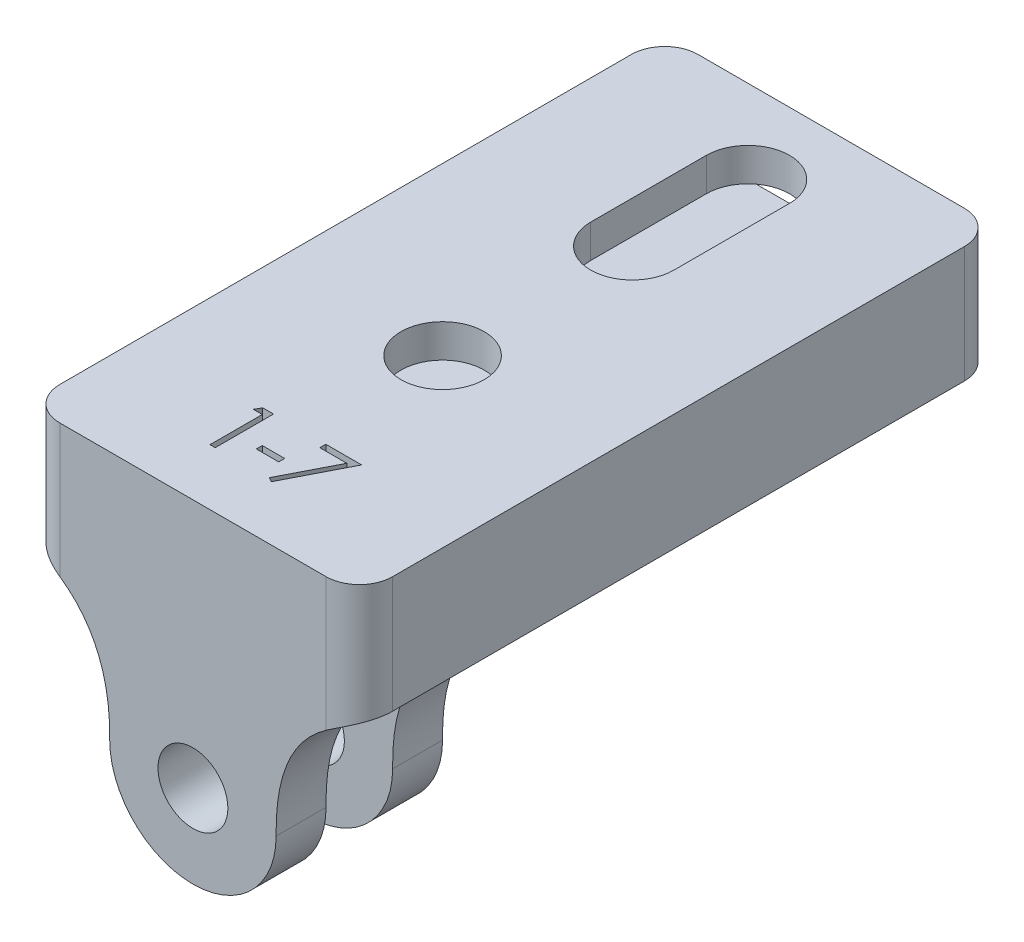
from build123d import *

# Parameters (mm, degrees)
SKETCH1_W           = 20
SKETCH1_H           = 38.345137774
SKETCH1_R           = 2.5
BOSS_EXTRUDE1_DEPTH = 3.5
SKETCH1_3_W         = 15
SKETCH1_3_H         = 28.345137774
SKETCH1_3_R         = 2.5
CUT_EXTRUDE1_DEPTH  = 1.5
SKETCH4_R           = 2.1
BOSS_EXTRUDE3_DEPTH = 3
FILLET1_R           = 2
SKETCH6_W           = 1.346153846
SKETCH6_H           = 0.358974359
CUT_EXTRUDE3_DEPTH  = 0.8


with BuildPart() as part:
    # Sketch1 → Boss-Extrude1 (new, symmetric)
    with BuildSketch(Plane(origin=(0, 0, 0), x_dir=(1, 0, 0), z_dir=(0, 1, 0))):
        with Locations((62.5, -20.827431113)):
            Rectangle(SKETCH1_W, SKETCH1_H)
        with Locations((62.5, -25)):
            Circle(SKETCH1_R, mode=Mode.SUBTRACT)
        with BuildLine():
            ThreePointArc((65, -13.597928412), (62.5, -16.097928412), (60, -13.597928412))
            Line((60, -13.597928412), (60, -6.654862226))
            ThreePointArc((60, -6.654862226), (62.5, -4.154862226), (65, -6.654862226))
            Line((65, -6.654862226), (65, -13.597928412))
        make_face(mode=Mode.SUBTRACT)
    extrude(amount=BOSS_EXTRUDE1_DEPTH, both=True)

    # Sketch1<3> → Cut-Extrude1 (cut, symmetric)
    with BuildSketch(Plane(origin=(0, 0, 0), x_dir=(1, 0, 0), z_dir=(0, 1, 0))):
        with Locations((60, -15.827431113)):
            Rectangle(SKETCH1_3_W, SKETCH1_3_H)
        with Locations((62.5, -25)):
            Circle(SKETCH1_3_R, mode=Mode.SUBTRACT)
        with BuildLine():
            ThreePointArc((65, -13.597928412), (62.5, -16.097928412), (60, -13.597928412))
            Line((60, -13.597928412), (60, -12))
            Line((60, -12), (60, -6.654862226))
            ThreePointArc((60, -6.654862226), (62.5, -4.154862226), (65, -6.654862226))
            Line((65, -6.654862226), (65, -12))
            Line((65, -12), (65, -13.597928412))
        make_face(mode=Mode.SUBTRACT)
    extrude(amount=CUT_EXTRUDE1_DEPTH, both=True, mode=Mode.SUBTRACT)

    # Sketch4 → Boss-Extrude3 (add)
    with BuildSketch(Plane.XY.offset(40)):
        with BuildLine():
            Line((72.5, -3.5), (52.5, -3.5))
            add(Edge.make_bspline(
                [(52.5, -3.5), (57.609745826, -5.257737433), (57.5, -11.5)],
                knots=[0.010608607, 0.010608607, 0.010608607, 1.010608607, 1.010608607, 1.010608607], degree=2))
            ThreePointArc((57.5, -11.5), (62.5, -16.5), (67.5, -11.5))
            add(Edge.make_bspline(
                [(67.5, -11.5), (67.390254174, -5.257737433), (72.5, -3.5)],
                knots=[0, 0, 0, 1, 1, 1], degree=2))
        make_face()
        with Locations((62.5, -11.5)):
            Circle(SKETCH4_R, mode=Mode.SUBTRACT)
    boss_extrude3 = extrude(amount=-BOSS_EXTRUDE3_DEPTH)

    # Mirror1: Boss-Extrude3 across plane
    add(boss_extrude3.mirror(Plane(origin=(0, 0, 35), x_dir=(1, 0, 0), z_dir=(0, 0, -1))))

    # Fillet1
    fillet1_edges = [part.edges().sort_by_distance(p)[0] for p in [
        (52.5, 0, 40),
        (72.5, 0, 40),
        (72.5, 0, 1.654862226),
        (52.5, -2.5, 1.654862226),
        (52.5, 2.5, 1.654862226),
    ]]
    fillet(fillet1_edges, radius=FILLET1_R)

    # Sketch6 → Cut-Extrude3 (cut)
    with BuildSketch(Plane(origin=(0, 3.5, 0), x_dir=(1, 0, 0), z_dir=(0, 1, 0))):
        Polygon((59.812990659, -33.118124269), (60.460126075, -33.118124269), (60.460126075, -36.618124269), (60.146023511, -36.618124269), (60.146023511, -33.477098628), (59.607561973, -33.477098628), align=None)
        with Locations((62.43448505, -35.271970424)):
            Rectangle(SKETCH6_W, SKETCH6_H)
        Polygon((63.601151716, -33.118124269), (65.75499787, -33.118124269), (63.91525428, -36.707867859), (63.643920146, -36.558528917), (65.22354755, -33.477098628), (63.601151716, -33.477098628), align=None)
    extrude(amount=-CUT_EXTRUDE3_DEPTH, mode=Mode.SUBTRACT)


solid = part.part
